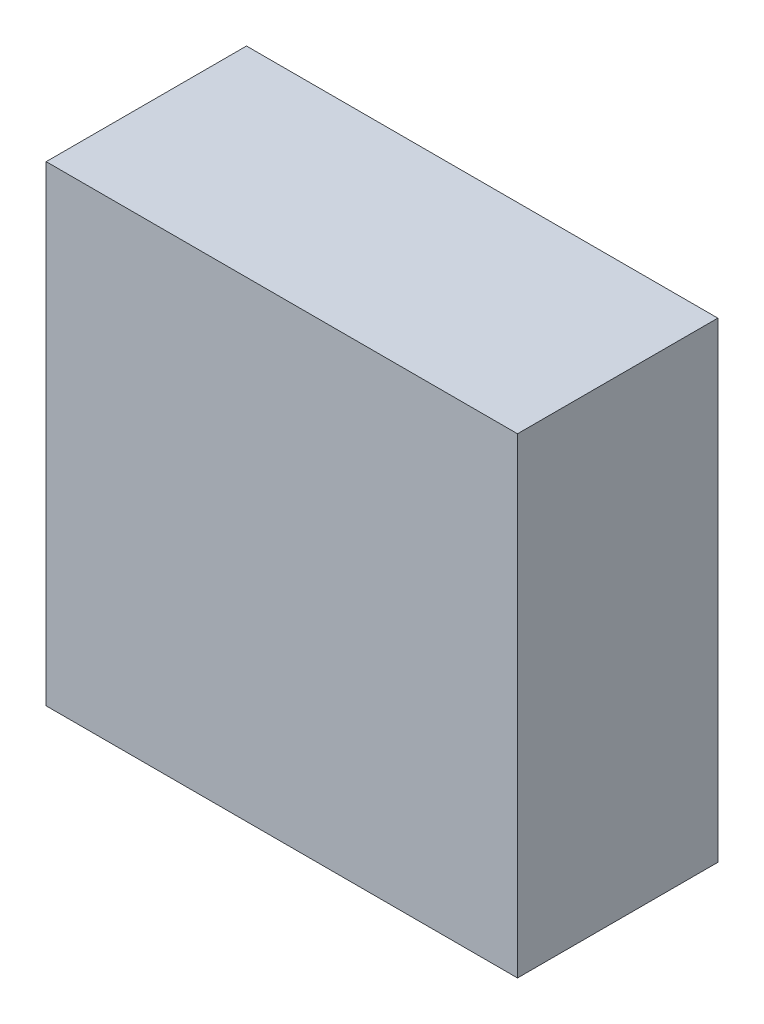
from build123d import *

# Parameters (mm, degrees)
SKETCH1_R           = 150
BOSS_EXTRUDE1_DEPTH = 50
SKETCH2_W           = 400
SKETCH2_H           = 400
SKETCH2_R           = 175
BOSS_EXTRUDE2_DEPTH = 60
SKETCH3_W           = 400
SKETCH3_H           = 400
BOSS_EXTRUDE3_DEPTH = 25


with BuildPart() as part:
    # Sketch1 → Boss-Extrude1 (new, symmetric)
    with BuildSketch(Plane.XY):
        Circle(SKETCH1_R)
    extrude(amount=BOSS_EXTRUDE1_DEPTH, both=True)


with BuildPart() as body_2:
    # Sketch2 → Boss-Extrude2 (new, symmetric)
    with BuildSketch(Plane.XY):
        Rectangle(SKETCH2_W, SKETCH2_H)
        Circle(SKETCH2_R, mode=Mode.SUBTRACT)
    extrude(amount=BOSS_EXTRUDE2_DEPTH, both=True)

    # Sketch3 → Boss-Extrude3 (add)
    with BuildSketch(Plane.XY.offset(60)):
        Rectangle(SKETCH3_W, SKETCH3_H)
    boss_extrude3 = extrude(amount=BOSS_EXTRUDE3_DEPTH)

    # Mirror1: Boss-Extrude3 across plane
    add(boss_extrude3.mirror(Plane.XY))


solid = Compound([part.part, body_2.part])
